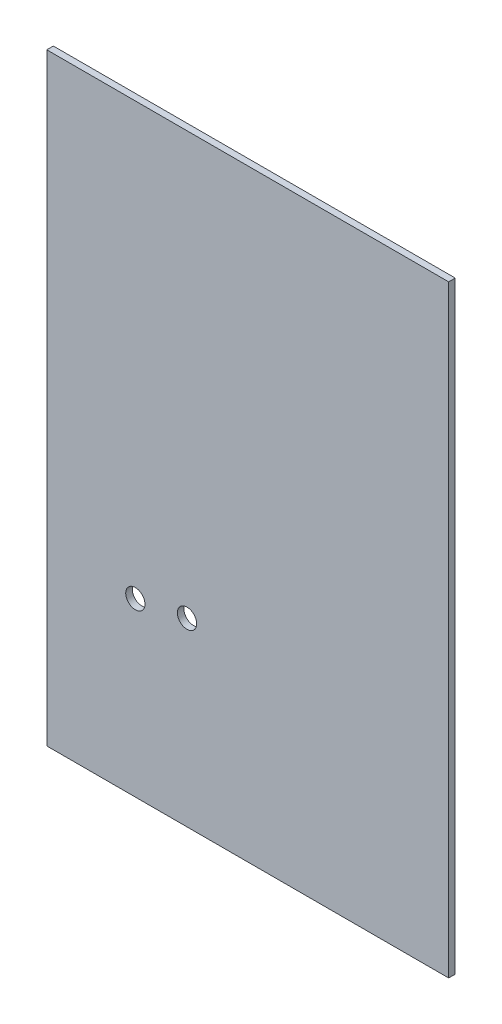
from build123d import *

# Parameters (mm, degrees)
SKETCH1_W           = 292.1
SKETCH1_H           = 438.15
SKETCH1_R           = 7
BOSS_EXTRUDE1_DEPTH = 4.7625


with BuildPart() as part:
    # Sketch1 → Boss-Extrude1 (new body)
    with BuildSketch(Plane.XY):
        with Locations((146.05, -219.075)):
            Rectangle(SKETCH1_W, SKETCH1_H)
        with Locations((101.925695163, -306.813385495)):
            Circle(SKETCH1_R, mode=Mode.SUBTRACT)
        with Locations((64.374426387, -313.256382727)):
            Circle(SKETCH1_R, mode=Mode.SUBTRACT)
    extrude(amount=BOSS_EXTRUDE1_DEPTH)


solid = part.part
